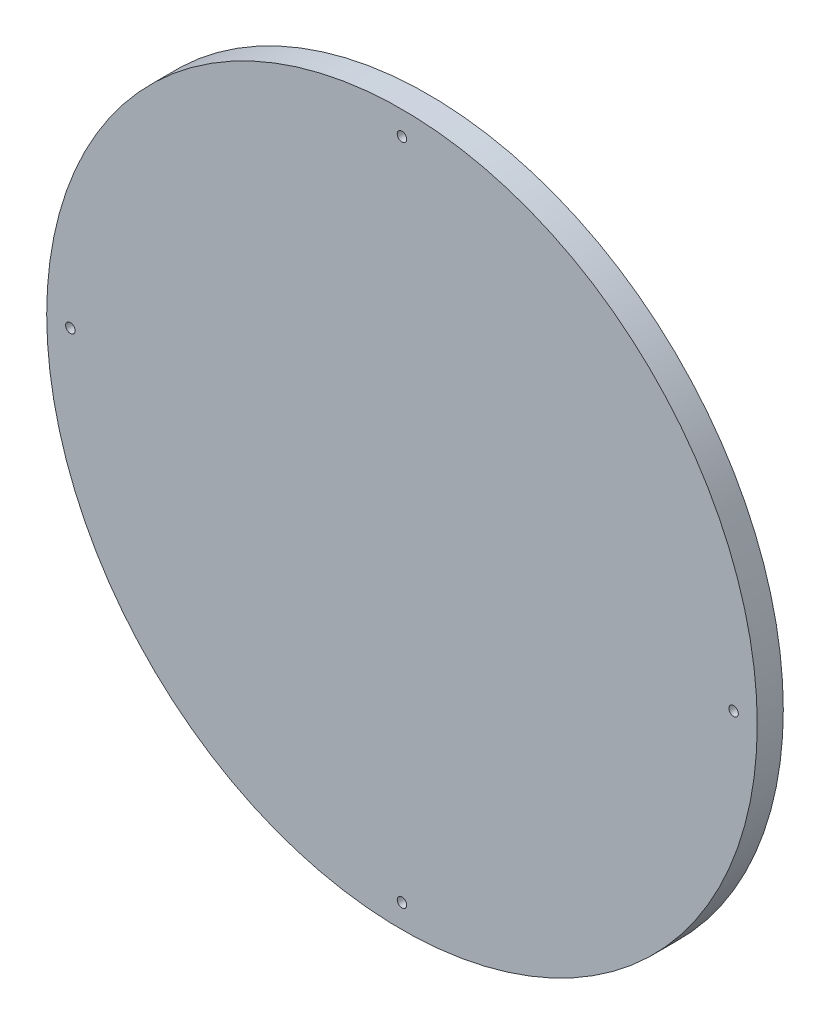
from build123d import *

# Parameters (mm, degrees)
ESQUISSE1_R                  = 300
BOSS_EXTRU_1_DEPTH           = 22
ESQUISSE2_R                  = 4
ENL_V_MAT_EXTRU_1_DEPTH      = 425.834085262
R_P_TITION_CIRCULAIRE1_COUNT = 4


with BuildPart() as part:
    # Esquisse1 → Boss.-Extru.1 (new body)
    with BuildSketch(Plane.XY):
        Circle(ESQUISSE1_R)
    extrude(amount=BOSS_EXTRU_1_DEPTH)

    # Esquisse2 → Enlèv. mat.-Extru.1 (cut, through all)
    with BuildSketch(Plane.XY.offset(22)):
        with Locations((0, 280)):
            Circle(ESQUISSE2_R)
    enl_v_mat_extru_1 = extrude(amount=-ENL_V_MAT_EXTRU_1_DEPTH, mode=Mode.SUBTRACT)

    # Répétition circulaire1: Enlèv. mat.-Extru.1 ×4 about axis
    r_p_tition_circulaire1_axis = Axis((0, 0, 22), (0, 0, 1))
    for i in range(1, R_P_TITION_CIRCULAIRE1_COUNT):
        add(enl_v_mat_extru_1.rotate(r_p_tition_circulaire1_axis, i * 360 / R_P_TITION_CIRCULAIRE1_COUNT), mode=Mode.SUBTRACT)


solid = part.part
